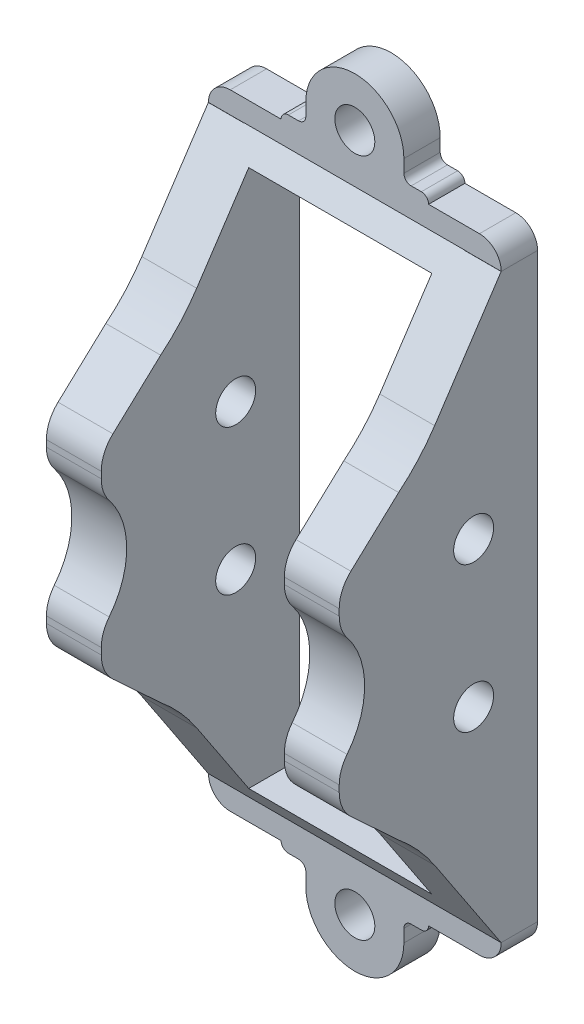
from build123d import *
from build123d.topology import SkipClean

# Parameters (mm, degrees)
SKETCH2_R               = 2.75
SKETCH2_W               = 8.45
SKETCH2_H               = 80
BOSS_EXTRUDE1_DEPTH     = 5
SKETCH4_W               = 3.4
SKETCH4_H               = 88
BOSS_EXTRUDE2_DEPTH     = 5
BOSS_EXTRUDE3_DEPTH     = 20.3
FILLET3_R               = 4.2
SKETCH7_W               = 8.45
SKETCH7_H               = 80
CUT_EXTRUDE1_DEPTH      = 38
FILLET4_R               = 3
FILLET5_R               = 1
BOSS_EXTRUDE4_START     = 5
BOSS_EXTRUDE4_DEPTH     = 5
BOSS_EXTRUDE5_DEPTH     = 5
CUT_EXTRUDE2_START      = -5
CUT_EXTRUDE2_DEPTH      = 5
CUT_EXTRUDE3_DEPTH      = 5
FILLET6_R               = 3
CUT_EXTRUDE4_DEPTH      = 140.468166751
CUT_EXTRUDE4_DEPTH_BACK = 140.468166751
BOSS_EXTRUDE6_START     = 3
BOSS_EXTRUDE6_DEPTH     = 3
BOSS_EXTRUDE7_DEPTH     = 3
BOSS_EXTRUDE8_DEPTH     = 2
BOSS_EXTRUDE9_START     = 2
BOSS_EXTRUDE9_DEPTH     = 2
BOSS_EXTRUDE10_DEPTH    = 5
FILLET8_R               = 3
CUT_EXTRUDE5_DEPTH      = 129.710283337
CUT_EXTRUDE5_DEPTH_BACK = 129.710283337
SKETCH21_R              = 2.75
BOSS_EXTRUDE11_DEPTH    = 40.3
CUT_EXTRUDE6_DEPTH      = 129.710283337
CUT_EXTRUDE6_DEPTH_BACK = 129.710283337
CUT_EXTRUDE7_DEPTH      = 129.107884223
CUT_EXTRUDE7_DEPTH_BACK = 129.107884223
FILLET9_R               = 5


with BuildPart() as part:
    # Sketch2 → Boss-Extrude1 (new body)
    with BuildSketch(Plane.XY):
        with BuildLine():
            Line((-58.75, 18.25), (-58.75, 111.75))
            ThreePointArc((-58.75, 111.75), (-52, 118.5), (-45.25, 111.75))
            Line((-45.25, 111.75), (-45.25, 18.25))
            ThreePointArc((-45.25, 18.25), (-52, 11.5), (-58.75, 18.25))
        make_face()
        with Locations((-52, 18.25)):
            Circle(SKETCH2_R, mode=Mode.SUBTRACT)
        with Locations((-52, 111.75)):
            Circle(SKETCH2_R, mode=Mode.SUBTRACT)
        with Locations((-52, 65)):
            Rectangle(SKETCH2_W, SKETCH2_H, mode=Mode.SUBTRACT)
    extrude(amount=BOSS_EXTRUDE1_DEPTH)

    # Sketch4 → Boss-Extrude2 (add)
    with BuildSketch(Plane.XY):
        with Locations((-60.45, 65)):
            Rectangle(SKETCH4_W, SKETCH4_H)
        with Locations((-43.55, 65)):
            Rectangle(SKETCH4_W, SKETCH4_H)
    extrude(amount=BOSS_EXTRUDE2_DEPTH)

    # Sketch5 → Boss-Extrude3 (add)
    with BuildSketch(Plane(origin=(-41.85, 0, 0), x_dir=(0, 0, -1), z_dir=(1, 0, 0))):
        with BuildLine():
            Line((-14.166666667, 38.797294107), (-5, 24.978024147))
            Line((-5, 24.978024147), (-5, 105.021975853))
            Line((-5, 105.021975853), (-14.166666667, 91.202705893))
            ThreePointArc((-14.166666667, 91.202705893), (-21.023858428, 84.293554139), (-30, 80.527078425))
            Line((-30, 80.527078425), (-30, 75.021975853))
            ThreePointArc((-30, 75.021975853), (-23.8, 65), (-30, 54.978024147))
            Line((-30, 54.978024147), (-30, 49.472921575))
            ThreePointArc((-30, 49.472921575), (-21.023858428, 45.706445861), (-14.166666667, 38.797294107))
        make_face()
    extrude(amount=-BOSS_EXTRUDE3_DEPTH)

    # Fillet3
    # the kernel refuses this fillet: 4.2 mm, written as the material it takes off along each edge
    with BuildSketch(Plane(origin=(-33.805211267, 80.527078425, 30), x_dir=(0, 0.2579921020094514, -0.9661470257164511), z_dir=(-1, 0, 0))) as fillet3_piece_1:
        with BuildLine():
            CenterArc((3.227620726, 4.192546311), FILLET3_R, 194.950953872, 71.635051289)
            Line((-0.830196782, 3.108979483), (0, 0))
            ThreePointArc((0, 0), (1.488754947, 0.044367195), (2.977509895, 0))
        make_face()
    extrude(amount=36.389577466, mode=Mode.SUBTRACT)
    with BuildSketch(Plane(origin=(-36.03019267, 54.978024147, 30), x_dir=(0, 0.5239775265852198, -0.8517320891181893), z_dir=(-1, 0, 0))) as fillet3_piece_2:
        with BuildLine():
            CenterArc((2.357495474, 4.183472274), FILLET3_R, 211.599436319, 53.315901995)
            Line((-1.2197793, 1.982766662), (0, 0))
            ThreePointArc((0, 0), (0.992629673, 0.044073937), (1.985259347, 0))
        make_face()
    extrude(amount=31.93961466, mode=Mode.SUBTRACT)
    with BuildSketch(Plane(origin=(-36.03019267, 75.021975853, 30), x_dir=(0, 1, 0), z_dir=(-1, 0, 0))) as fillet3_piece_3:
        with BuildLine():
            CenterArc((2.327922932, 4.2), FILLET3_R, 216.684098005, 53.315901995)
            ThreePointArc((-1.040231282, 1.690909091), (-0.482576455, 0.868548298), (0, 0))
            Line((0, 0), (2.327922932, 0))
        make_face()
    extrude(amount=31.93961466, mode=Mode.SUBTRACT)
    with BuildSketch(Plane(origin=(-33.805211267, 49.472921575, 30), x_dir=(0, -0.25799210200945616, -0.96614702571645), z_dir=(-1, 0, 0))) as fillet3_piece_4:
        with BuildLine():
            CenterArc((3.227620726, -4.192546311), FILLET3_R, 93.413994839, 71.635051289)
            Line((-0.830196782, -3.108979483), (0, 0))
            ThreePointArc((0, 0), (1.488754947, -0.044367195), (2.977509895, 0))
        make_face()
    extrude(amount=36.389577466, mode=Mode.SUBTRACT)

    # Sketch7 → Cut-Extrude1 (cut)
    with BuildSketch(Plane(origin=(0, 0, 5), x_dir=(-1, 0, 0), z_dir=(0, 0, -1))):
        with Locations((52, 65)):
            Rectangle(SKETCH7_W, SKETCH7_H)
    extrude(amount=-CUT_EXTRUDE1_DEPTH, mode=Mode.SUBTRACT)

    # Fillet4
    fillet4_edges = [part.edges().sort_by_distance(p)[0] for p in [
        (-56.225, 105, 2.507288566),
        (-56.225, 25, 2.507288566),
        (-47.775, 25, 2.507288566),
        (-47.775, 105, 2.507288566),
    ]]
    fillet(fillet4_edges, radius=FILLET4_R)

    # Fillet5
    fillet5_edges = [part.edges().sort_by_distance(p)[0] for p in [
        (-62.15, 21, 2.5),
        (-58.75, 21, 2.5),
        (-41.85, 109, 2.5),
        (-45.25, 109, 2.5),
        (-62.15, 109, 2.5),
        (-45.25, 21, 2.5),
        (-41.85, 21, 2.5),
        (-58.75, 109, 2.5),
    ]]
    fillet(fillet5_edges, radius=FILLET5_R)

    # Sketch8 → Boss-Extrude4 (add)
    with SkipClean():  # the faces are left unmerged after this step: merging them gives an invalid solid
        with BuildSketch(Plane(origin=(-41.85, 0, 0), x_dir=(0, 0, -1), z_dir=(1, 0, 0)).offset(BOSS_EXTRUDE4_START)):
            with BuildLine():
                Line((0, 22), (0, 108))
                Line((0, 108), (-5, 108))
                Line((-5, 108), (-5, 105.021975853))
                Line((-5, 105.021975853), (-14.166666667, 91.202705893))
                ThreePointArc((-14.166666667, 91.202705893), (-19.814280101, 85.162622612), (-27.123287671, 81.295252462))
                ThreePointArc((-27.123287671, 81.295252462), (-29.199746644, 79.775277843), (-29.999950613, 77.329530859))
                ThreePointArc((-29.999950613, 77.329530859), (-29.548963562, 75.45641728), (-28.309090909, 73.981744571))
                ThreePointArc((-28.309090909, 73.981744571), (-23.8, 65), (-28.309090909, 56.018255429))
                ThreePointArc((-28.309090909, 56.018255429), (-29.548963562, 54.54358272), (-29.999950613, 52.670469141))
                ThreePointArc((-29.999950613, 52.670469141), (-29.199746644, 50.224722157), (-27.123287671, 48.704747538))
                ThreePointArc((-27.123287671, 48.704747538), (-19.814280101, 44.837377388), (-14.166666667, 38.797294107))
                Line((-14.166666667, 38.797294107), (-5, 24.978024147))
                Line((-5, 24.978024147), (-5, 22))
                Line((-5, 22), (0, 22))
            make_face()
        extrude(amount=-BOSS_EXTRUDE4_DEPTH)

    # Sketch9 → Boss-Extrude5 (add)
    with SkipClean():  # the faces are left unmerged after this step: merging them gives an invalid solid
        with BuildSketch(Plane.ZY.offset(62.15)):
            with BuildLine():
                Line((5, 105.021975853), (5, 108))
                Line((5, 108), (0, 108))
                Line((0, 108), (0, 22))
                Line((0, 22), (5, 22))
                Line((5, 22), (5, 24.978024147))
                Line((5, 24.978024147), (14.166666667, 38.797294107))
                ThreePointArc((14.166666667, 38.797294107), (19.814280101, 44.837377388), (27.123287671, 48.704747538))
                ThreePointArc((27.123287671, 48.704747538), (29.199746644, 50.224722157), (29.999950613, 52.670469141))
                ThreePointArc((29.999950613, 52.670469141), (29.548963562, 54.54358272), (28.309090909, 56.018255429))
                ThreePointArc((28.309090909, 56.018255429), (23.8, 65), (28.309090909, 73.981744571))
                ThreePointArc((28.309090909, 73.981744571), (29.548963562, 75.45641728), (29.999950613, 77.329530859))
                ThreePointArc((29.999950613, 77.329530859), (29.199746644, 79.775277843), (27.123287671, 81.295252462))
                ThreePointArc((27.123287671, 81.295252462), (19.814280101, 85.162622612), (14.166666667, 91.202705893))
                Line((14.166666667, 91.202705893), (5, 105.021975853))
            make_face()
        extrude(amount=BOSS_EXTRUDE5_DEPTH)

    # Sketch10 → Cut-Extrude2 (cut)
    with SkipClean():  # the faces are left unmerged after this step: merging them gives an invalid solid
        with BuildSketch(Plane.ZY.offset(47.775).offset(CUT_EXTRUDE2_START)):
            with BuildLine():
                Line((14.166666667, 91.202705893), (7.004552006, 102))
                Line((7.004552006, 102), (0, 102))
                Line((0, 102), (0, 28))
                Line((0, 28), (7.004552006, 28))
                Line((7.004552006, 28), (14.166666667, 38.797294107))
                ThreePointArc((14.166666667, 38.797294107), (19.814280101, 44.837377388), (27.123287671, 48.704747538))
                ThreePointArc((27.123287671, 48.704747538), (29.199746644, 50.224722157), (29.999950613, 52.670469141))
                ThreePointArc((29.999950613, 52.670469141), (29.548963562, 54.54358272), (28.309090909, 56.018255429))
                ThreePointArc((28.309090909, 56.018255429), (23.8, 65), (28.309090909, 73.981744571))
                ThreePointArc((28.309090909, 73.981744571), (29.548963562, 75.45641728), (29.999950613, 77.329530859))
                ThreePointArc((29.999950613, 77.329530859), (29.199746644, 79.775277843), (27.123287671, 81.295252462))
                ThreePointArc((27.123287671, 81.295252462), (19.814280101, 85.162622612), (14.166666667, 91.202705893))
            make_face()
        extrude(amount=CUT_EXTRUDE2_DEPTH, mode=Mode.SUBTRACT)

    # Sketch11 → Cut-Extrude3 (cut)
    with SkipClean():  # the faces are left unmerged after this step: merging them gives an invalid solid
        with BuildSketch(Plane(origin=(-56.225, 0, 0), x_dir=(0, 0, -1), z_dir=(1, 0, 0))):
            with BuildLine():
                Line((0, 28), (0, 102))
                Line((0, 102), (-7.004552006, 102))
                Line((-7.004552006, 102), (-14.166666667, 91.202705893))
                ThreePointArc((-14.166666667, 91.202705893), (-19.814280101, 85.162622612), (-27.123287671, 81.295252462))
                ThreePointArc((-27.123287671, 81.295252462), (-29.199746644, 79.775277843), (-29.999950613, 77.329530859))
                ThreePointArc((-29.999950613, 77.329530859), (-29.548963562, 75.45641728), (-28.309090909, 73.981744571))
                ThreePointArc((-28.309090909, 73.981744571), (-23.8, 65), (-28.309090909, 56.018255429))
                ThreePointArc((-28.309090909, 56.018255429), (-29.548963562, 54.54358272), (-29.999950613, 52.670469141))
                ThreePointArc((-29.999950613, 52.670469141), (-29.199746644, 50.224722157), (-27.123287671, 48.704747538))
                ThreePointArc((-27.123287671, 48.704747538), (-19.814280101, 44.837377388), (-14.166666667, 38.797294107))
                Line((-14.166666667, 38.797294107), (-7.004552006, 28))
                Line((-7.004552006, 28), (0, 28))
            make_face()
        extrude(amount=-CUT_EXTRUDE3_DEPTH, mode=Mode.SUBTRACT)

    # Fillet6
    fillet6_edges = [part.edges().sort_by_distance(p)[0] for p in [
        (-67.15, 22, 2.5),
        (-36.85, 22, 2.5),
        (-36.85, 108, 2.5),
        (-67.15, 108, 2.5),
    ]]
    fillet(fillet6_edges, radius=FILLET6_R)

    # Sketch12 → Cut-Extrude4 (cut, two sides: drawn at the far end of the back side and taken through both)
    with BuildSketch(Plane(origin=(0, 0, 0), x_dir=(-1, 0, 0), z_dir=(0, 0, -1)).offset(-CUT_EXTRUDE4_DEPTH_BACK)):
        Polygon((42.775, 102), (42.775, 28), (47.775, 28), (56.225, 28), (61.225, 28), (61.225, 102), (56.225, 102), (47.775, 102), align=None)
        Polygon((61.225, 102), (61.225, 28), (64, 28), (64, 75), (64, 102), align=None)
        with BuildLine():
            Line((61.225, 28), (56.225, 28))
            ThreePointArc((56.225, 28), (56.209808459, 27.698473114), (56.164387691, 27.4))
            Line((56.164387691, 27.4), (61.225, 27.4))
            Line((61.225, 27.4), (64.6, 27.4))
            Line((64.6, 27.4), (64.6, 102))
            Line((64.6, 102), (64.6, 102.6))
            Line((64.6, 102.6), (64, 102.6))
            Line((64, 102.6), (56.164387691, 102.6))
            ThreePointArc((56.164387691, 102.6), (56.209808459, 102.301526886), (56.225, 102))
            Line((56.225, 102), (61.225, 102))
            Line((61.225, 102), (64, 102))
            Line((64, 102), (64, 75))
            Line((64, 75), (64, 28))
            Line((64, 28), (61.225, 28))
        make_face()
        with BuildLine():
            Line((56.225, 28), (47.775, 28))
            ThreePointArc((47.775, 28), (47.790191541, 27.698473114), (47.835612309, 27.4))
            Line((47.835612309, 27.4), (56.164387691, 27.4))
            ThreePointArc((56.164387691, 27.4), (56.209808459, 27.698473114), (56.225, 28))
        make_face()
        Polygon((40, 55), (40, 100.870302184), (40, 102), (42.775, 102), (42.775, 28), (40, 28), align=None)
        with BuildLine():
            Line((40, 28), (40, 55))
            Line((40, 55), (40, 100.870302184))
            Line((40, 100.870302184), (40, 102))
            Line((40, 102), (42.775, 102))
            Line((42.775, 102), (47.775, 102))
            ThreePointArc((47.775, 102), (47.790191541, 102.301526886), (47.835612309, 102.6))
            Line((47.835612309, 102.6), (40, 102.6))
            Line((40, 102.6), (39.4, 102.6))
            Line((39.4, 102.6), (39.4, 102))
            Line((39.4, 102), (39.4, 100.870302184))
            Line((39.4, 100.870302184), (39.4, 55))
            Line((39.4, 55), (39.4, 27.4))
            Line((39.4, 27.4), (42.775, 27.4))
            Line((42.775, 27.4), (47.835612309, 27.4))
            ThreePointArc((47.835612309, 27.4), (47.790191541, 27.698473114), (47.775, 28))
            Line((47.775, 28), (42.775, 28))
            Line((42.775, 28), (40, 28))
        make_face()
        with BuildLine():
            ThreePointArc((47.835612309, 102.6), (47.790191541, 102.301526886), (47.775, 102))
            Line((47.775, 102), (56.225, 102))
            ThreePointArc((56.225, 102), (56.209808459, 102.301526886), (56.164387691, 102.6))
            Line((56.164387691, 102.6), (47.835612309, 102.6))
        make_face()
    extrude(amount=CUT_EXTRUDE4_DEPTH + CUT_EXTRUDE4_DEPTH_BACK, mode=Mode.SUBTRACT)

    # Sketch14 → Boss-Extrude6 (add)
    with BuildSketch(Plane(origin=(-36.85, 0, 0), x_dir=(0, 0, -1), z_dir=(1, 0, 0)).offset(BOSS_EXTRUDE6_START)):
        with BuildLine():
            Line((-14.166666667, 38.797294107), (-5.014577132, 25))
            Line((-5.014577132, 25), (0, 25))
            Line((0, 25), (0, 105))
            Line((0, 105), (-5.014577132, 105))
            Line((-5.014577132, 105), (-14.166666667, 91.202705893))
            ThreePointArc((-14.166666667, 91.202705893), (-19.814280101, 85.162622612), (-27.123287671, 81.295252462))
            ThreePointArc((-27.123287671, 81.295252462), (-29.199746644, 79.775277843), (-29.999950613, 77.329530859))
            ThreePointArc((-29.999950613, 77.329530859), (-29.548963562, 75.45641728), (-28.309090909, 73.981744571))
            ThreePointArc((-28.309090909, 73.981744571), (-23.8, 65), (-28.309090909, 56.018255429))
            ThreePointArc((-28.309090909, 56.018255429), (-29.548963562, 54.54358272), (-29.999950613, 52.670469141))
            ThreePointArc((-29.999950613, 52.670469141), (-29.199746644, 50.224722157), (-27.123287671, 48.704747538))
            ThreePointArc((-27.123287671, 48.704747538), (-19.814280101, 44.837377388), (-14.166666667, 38.797294107))
        make_face()
    extrude(amount=-BOSS_EXTRUDE6_DEPTH)

    # Sketch15 → Boss-Extrude7 (add)
    with BuildSketch(Plane.ZY.offset(67.15)):
        with BuildLine():
            Line((0, 105), (0, 25))
            Line((0, 25), (5.014577132, 25))
            Line((5.014577132, 25), (14.166666667, 38.797294107))
            ThreePointArc((14.166666667, 38.797294107), (19.814280101, 44.837377388), (27.123287671, 48.704747538))
            ThreePointArc((27.123287671, 48.704747538), (29.199746644, 50.224722157), (29.999950613, 52.670469141))
            ThreePointArc((29.999950613, 52.670469141), (29.548963562, 54.54358272), (28.309090909, 56.018255429))
            ThreePointArc((28.309090909, 56.018255429), (23.8, 65), (28.309090909, 73.981744571))
            ThreePointArc((28.309090909, 73.981744571), (29.548963562, 75.45641728), (29.999950613, 77.329530859))
            ThreePointArc((29.999950613, 77.329530859), (29.199746644, 79.775277843), (27.123287671, 81.295252462))
            ThreePointArc((27.123287671, 81.295252462), (19.814280101, 85.162622612), (14.166666667, 91.202705893))
            Line((14.166666667, 91.202705893), (5.014577132, 105))
            Line((5.014577132, 105), (0, 105))
        make_face()
    extrude(amount=BOSS_EXTRUDE7_DEPTH)

    # Sketch17 → Boss-Extrude8 (add)
    with BuildSketch(Plane.ZY.offset(70.15)):
        with BuildLine():
            Line((5.014577132, 105), (0, 105))
            Line((0, 105), (0, 25))
            Line((0, 25), (5.014577132, 25))
            Line((5.014577132, 25), (14.166666667, 38.797294107))
            ThreePointArc((14.166666667, 38.797294107), (19.814280101, 44.837377388), (27.123287671, 48.704747538))
            ThreePointArc((27.123287671, 48.704747538), (29.199746644, 50.224722157), (29.999950613, 52.670469141))
            ThreePointArc((29.999950613, 52.670469141), (29.548963562, 54.54358272), (28.309090909, 56.018255429))
            ThreePointArc((28.309090909, 56.018255429), (23.8, 65), (28.309090909, 73.981744571))
            ThreePointArc((28.309090909, 73.981744571), (29.548963562, 75.45641728), (29.999950613, 77.329530859))
            ThreePointArc((29.999950613, 77.329530859), (29.199746644, 79.775277843), (27.123287671, 81.295252462))
            ThreePointArc((27.123287671, 81.295252462), (19.814280101, 85.162622612), (14.166666667, 91.202705893))
            Line((14.166666667, 91.202705893), (5.014577132, 105))
        make_face()
    extrude(amount=BOSS_EXTRUDE8_DEPTH)

    # Sketch18 → Boss-Extrude9 (add)
    with BuildSketch(Plane(origin=(-33.85, 0, 0), x_dir=(0, 0, -1), z_dir=(1, 0, 0)).offset(BOSS_EXTRUDE9_START)):
        with BuildLine():
            Line((-14.166666667, 38.797294107), (-5.014577132, 25))
            Line((-5.014577132, 25), (0, 25))
            Line((0, 25), (0, 105))
            Line((0, 105), (-5.014577132, 105))
            Line((-5.014577132, 105), (-14.166666667, 91.202705893))
            ThreePointArc((-14.166666667, 91.202705893), (-19.814280101, 85.162622612), (-27.123287671, 81.295252462))
            ThreePointArc((-27.123287671, 81.295252462), (-29.199746644, 79.775277843), (-29.999950613, 77.329530859))
            ThreePointArc((-29.999950613, 77.329530859), (-29.548963562, 75.45641728), (-28.309090909, 73.981744571))
            ThreePointArc((-28.309090909, 73.981744571), (-23.8, 65), (-28.309090909, 56.018255429))
            ThreePointArc((-28.309090909, 56.018255429), (-29.548963562, 54.54358272), (-29.999950613, 52.670469141))
            ThreePointArc((-29.999950613, 52.670469141), (-29.199746644, 50.224722157), (-27.123287671, 48.704747538))
            ThreePointArc((-27.123287671, 48.704747538), (-19.814280101, 44.837377388), (-14.166666667, 38.797294107))
        make_face()
    extrude(amount=-BOSS_EXTRUDE9_DEPTH)

    # Sketch20 → Boss-Extrude10 (add)
    with BuildSketch(Plane.XY.offset(5)):
        Polygon((-64.15, 108), (-39.85, 108), (-31.85, 108), (-31.85, 105), (-72.15, 105), (-72.15, 108), align=None)
        with BuildLine():
            Line((-31.85, 25), (-31.85, 22))
            Line((-31.85, 22), (-39.85, 22))
            ThreePointArc((-39.85, 22), (-37.736463575, 22.870924196), (-36.850080491, 24.978024147))
            Line((-36.850080491, 24.978024147), (-67.149919509, 24.978024147))
            ThreePointArc((-67.149919509, 24.978024147), (-66.263536425, 22.870924196), (-64.15, 22))
            Line((-64.15, 22), (-72.15, 22))
            Line((-72.15, 22), (-72.15, 25))
            Line((-72.15, 25), (-31.85, 25))
        make_face()
        with BuildLine():
            ThreePointArc((-67.149919509, 24.978024147), (-66.263536425, 22.870924196), (-64.15, 22))
            Line((-64.15, 22), (-62.15, 22))
            Line((-62.15, 22), (-41.85, 22))
            Line((-41.85, 22), (-39.85, 22))
            ThreePointArc((-39.85, 22), (-37.736463575, 22.870924196), (-36.850080491, 24.978024147))
            Line((-36.850080491, 24.978024147), (-67.149919509, 24.978024147))
        make_face()
    extrude(amount=-BOSS_EXTRUDE10_DEPTH)

    # Fillet8
    fillet8_edges = [part.edges().sort_by_distance(p)[0] for p in [
        (-31.85, 108, 2.5),
        (-72.15, 108, 2.5),
        (-31.85, 22, 2.5),
        (-72.15, 22, 2.5),
    ]]
    fillet(fillet8_edges, radius=FILLET8_R)

    # Sketch21 → Cut-Extrude5 (cut, two sides: drawn at the far end of the back side and taken through both)
    with BuildSketch(Plane(origin=(-31.85, 0, 0), x_dir=(0, 0, -1), z_dir=(1, 0, 0)).offset(-CUT_EXTRUDE5_DEPTH_BACK)):
        with Locations((-8.8, 55)):
            Circle(SKETCH21_R)
        with Locations((-8.8, 75)):
            Circle(SKETCH21_R)
    extrude(amount=CUT_EXTRUDE5_DEPTH + CUT_EXTRUDE5_DEPTH_BACK, mode=Mode.SUBTRACT)

    # Sketch24 → Boss-Extrude11 (add)
    with BuildSketch(Plane(origin=(-31.85, 0, 0), x_dir=(0, 0, -1), z_dir=(1, 0, 0))):
        Polygon((-7.004552006, 102), (0, 102), (0, 105), (-5, 105), (-5.014577132, 105), align=None)
        Polygon((-5, 25), (0, 25), (0, 28), (-7.004552006, 28), (-5.014577132, 25), align=None)
    extrude(amount=-BOSS_EXTRUDE11_DEPTH)

    # Sketch28 → Cut-Extrude6 (cut, two sides: drawn at the far end of the back side and taken through both)
    with BuildSketch(Plane.ZY.offset(72.15).offset(-CUT_EXTRUDE6_DEPTH_BACK)):
        with BuildLine():
            Line((27.3, 81.232171981), (27.3, 73.133265027))
            ThreePointArc((27.3, 73.133265027), (27.792049841, 73.572365747), (28.309090909, 73.981744571))
            ThreePointArc((28.309090909, 73.981744571), (29.548963562, 75.45641728), (29.999950613, 77.329530859))
            ThreePointArc((29.999950613, 77.329530859), (29.253984826, 79.698721222), (27.3, 81.232171981))
        make_face()
        with BuildLine():
            ThreePointArc((28.309090909, 56.018255429), (27.792049841, 56.427634253), (27.3, 56.866734973))
            Line((27.3, 56.866734973), (27.3, 48.767828019))
            ThreePointArc((27.3, 48.767828019), (29.253984826, 50.301278778), (29.999950613, 52.670469141))
            ThreePointArc((29.999950613, 52.670469141), (29.548963562, 54.54358272), (28.309090909, 56.018255429))
        make_face()
    extrude(amount=CUT_EXTRUDE6_DEPTH + CUT_EXTRUDE6_DEPTH_BACK, mode=Mode.SUBTRACT)

    # Sketch30 → Cut-Extrude7 (cut, two sides: drawn at the far end of the back side and taken through both)
    with BuildSketch(Plane.ZY.offset(72.15).offset(-CUT_EXTRUDE7_DEPTH_BACK)):
        with BuildLine():
            Line((19.125884799, 85.708445192), (27.3, 78.133265027))
            Line((27.3, 78.133265027), (27.3, 81.232171981))
            ThreePointArc((27.3, 81.232171981), (27.211996142, 81.264699166), (27.123287671, 81.295252462))
            ThreePointArc((27.123287671, 81.295252462), (22.921319625, 83.133497596), (19.125884799, 85.708445192))
        make_face()
        with BuildLine():
            Line((27.3, 48.767828019), (27.3, 51.866734973))
            Line((27.3, 51.866734973), (19.125884799, 44.291554808))
            ThreePointArc((19.125884799, 44.291554808), (22.921319625, 46.866502404), (27.123287671, 48.704747538))
            ThreePointArc((27.123287671, 48.704747538), (27.211996142, 48.735300834), (27.3, 48.767828019))
        make_face()
    extrude(amount=CUT_EXTRUDE7_DEPTH + CUT_EXTRUDE7_DEPTH_BACK, mode=Mode.SUBTRACT)

    # Fillet9
    fillet9_edges = [part.edges().sort_by_distance(p)[0] for p in [
        (-35.625, 73.133265027, 27.3),
        (-68.375, 73.133265027, 27.3),
        (-35.625, 56.866734973, 27.3),
        (-68.375, 56.866734973, 27.3),
        (-68.375, 78.133265027, 27.3),
        (-68.375, 51.866734973, 27.3),
        (-35.625, 78.133265027, 27.3),
        (-35.625, 51.866734973, 27.3),
    ]]
    fillet(fillet9_edges, radius=FILLET9_R)


solid = part.part
